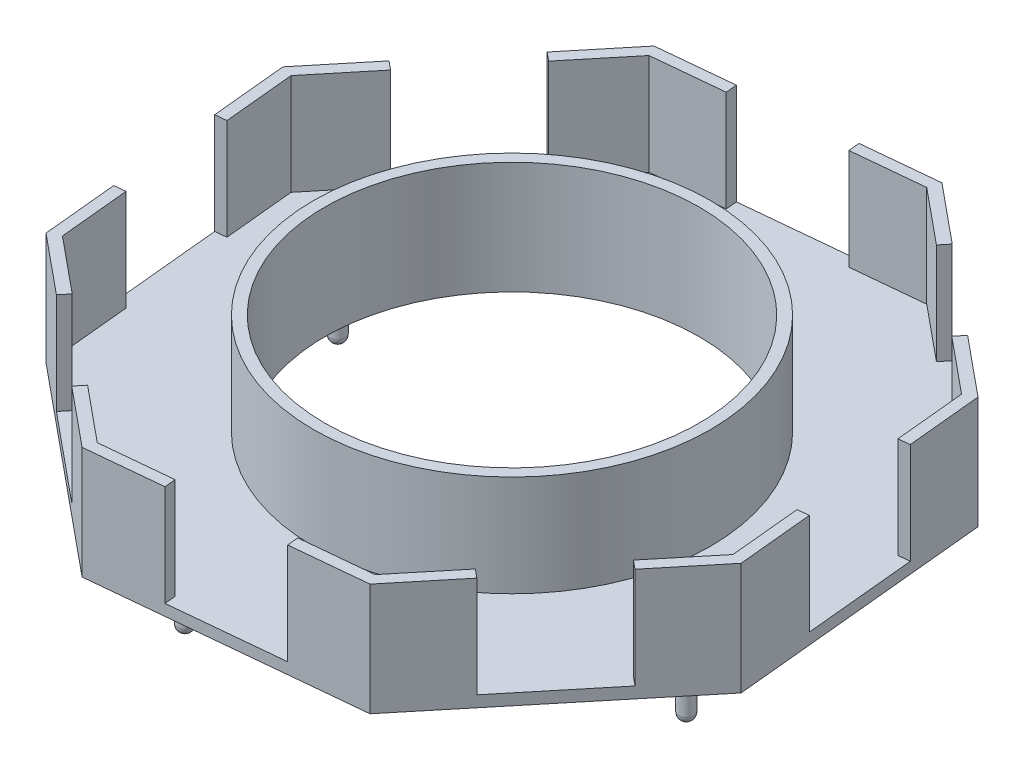
from build123d import *

# Parameters (mm, degrees)
SKETCH1_R           = 50
BOSS_EXTRUDE1_DEPTH = 30
SKETCH2_R           = 2
BOSS_EXTRUDE2_DEPTH = 20
FILLET1_R           = 2
SHELL1_START        = 3
SHELL1_OUTLINE_R    = 53
SHELL1_DEPTH        = 27
CUT_EXTRUDE1_DEPTH  = 27


# Read off the part's stored shape, not the designer's step: Shell1
with BuildPart() as part:
    # Sketch1 → Boss-Extrude1 (new body)
    with BuildSketch(Plane(origin=(0, 0, 0), x_dir=(1, 0, 0), z_dir=(0, 1, 0))):
        Polygon((-43.26756368, 81.194408409), (-88.007904464, 26.818329097), (-81.194408409, -43.26756368), (-26.818329097, -88.007904464), (43.26756368, -81.194408409), (88.007904464, -26.818329097), (81.194408409, 43.26756368), (26.818329097, 88.007904464), align=None)
        with Locations(Location((0, 0, 0), (0, 0, 270))):
            Circle(SKETCH1_R, mode=Mode.SUBTRACT)
    extrude(amount=BOSS_EXTRUDE1_DEPTH)

    # Sketch2 → Boss-Extrude2 (add)
    with BuildSketch(Plane(origin=(0, 0, 0), x_dir=(-1, 0, 0), z_dir=(0, -1, 0))):
        with Locations(Location((66.960107228, 20.404510287, 0), (0, 0, 270))):
            Circle(SKETCH2_R)
        with Locations(Location((20.404510287, -66.960107228, 0), (0, 0, 270))):
            Circle(SKETCH2_R)
        with Locations(Location((-66.960107228, -20.404510287, 0), (0, 0, 270))):
            Circle(SKETCH2_R)
        with Locations(Location((-20.404510287, 66.960107228, 0), (0, 0, 270))):
            Circle(SKETCH2_R)
    extrude(amount=BOSS_EXTRUDE2_DEPTH)

    # Fillet1
    fillet1_edges = [part.edges().sort_by_distance(p)[0] for p in [
        (-66.960107228, 0, -22.404510287),
        (-66.960107228, -20, -22.404510287),
        (-20.404510287, 0, 64.960107228),
        (-20.404510287, -20, 64.960107228),
        (66.960107228, 0, 18.404510287),
        (66.960107228, -20, 18.404510287),
        (20.404510287, 0, -68.960107228),
        (20.404510287, -20, -68.960107228),
    ]]
    fillet(fillet1_edges, radius=FILLET1_R)

    # Shell1 outline → Shell1 (cut)
    with BuildSketch(Plane(origin=(0, 0, 0), x_dir=(1, 0, 0), z_dir=(0, 1, 0)).offset(SHELL1_START)):
        Polygon((25.871799834, 84.90174313), (-41.740473197, 78.328723406), (-84.90174313, 25.871799834), (-78.328723406, -41.740473197), (-25.871799834, -84.90174313), (41.740473197, -78.328723406), (84.90174313, -25.871799834), (78.328723406, 41.740473197), align=None)
        Circle(SHELL1_OUTLINE_R, mode=Mode.SUBTRACT)
    extrude(amount=SHELL1_DEPTH, mode=Mode.SUBTRACT)

    # Sketch3 → Cut-Extrude1 (cut)
    with BuildSketch(Plane(origin=(0, 30, 0), x_dir=(1, 0, 0), z_dir=(0, 1, 0))):
        Polygon((6.634614392, 86.045716996), (6.924895002, 83.059793827), (-22.934336682, 80.156987724), (-23.224617292, 83.142910893), align=None)
        Polygon((63.628783674, 53.835503244), (40.46252459, 72.896574569), (42.368631722, 75.213200477), (65.534890807, 56.152129153), align=None)
        Polygon((83.059793827, -6.924895002), (80.156987724, 22.934336682), (83.142910893, 23.224617292), (86.045716996, -6.634614392), align=None)
        Polygon((53.835503244, -63.628783674), (72.896574569, -40.46252459), (75.213200477, -42.368631722), (56.152129153, -65.534890807), align=None)
        Polygon((-6.924895002, -83.059793827), (22.934336682, -80.156987724), (23.224617292, -83.142910893), (-6.634614392, -86.045716996), align=None)
        Polygon((-63.628783674, -53.835503244), (-40.46252459, -72.896574569), (-42.368631722, -75.213200477), (-65.534890807, -56.152129153), align=None)
        Polygon((-83.059793827, 6.924895002), (-80.156987724, -22.934336682), (-83.142910893, -23.224617292), (-86.045716996, 6.634614392), align=None)
        Polygon((-53.835503244, 63.628783674), (-72.896574569, 40.46252459), (-75.213200477, 42.368631722), (-56.152129153, 65.534890807), align=None)
    extrude(amount=-CUT_EXTRUDE1_DEPTH, mode=Mode.SUBTRACT)


solid = part.part
